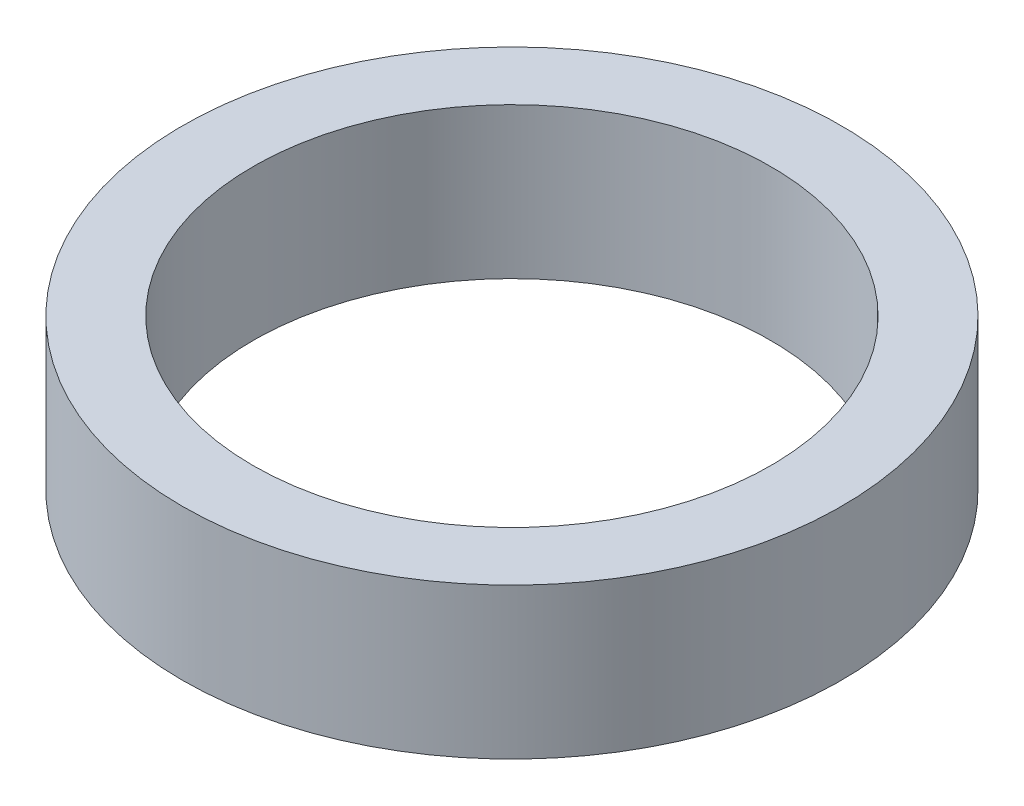
from build123d import *

# Parameters (mm, degrees)
SKETCH1_R           = 35
BOSS_EXTRUDE1_DEPTH = 16
SKETCH2_R           = 27.5
CUT_EXTRUDE1_DEPTH  = 53.019227215


with BuildPart() as part:
    # Sketch1 → Boss-Extrude1 (new body)
    with BuildSketch(Plane(origin=(0, 0, 0), x_dir=(1, 0, 0), z_dir=(0, 1, 0))):
        Circle(SKETCH1_R)
    extrude(amount=BOSS_EXTRUDE1_DEPTH)

    # Sketch2 → Cut-Extrude1 (cut, through all)
    with BuildSketch(Plane(origin=(0, 0, 0), x_dir=(1, 0, 0), z_dir=(0, 1, 0))):
        Circle(SKETCH2_R)
    extrude(amount=CUT_EXTRUDE1_DEPTH, mode=Mode.SUBTRACT)


solid = part.part
